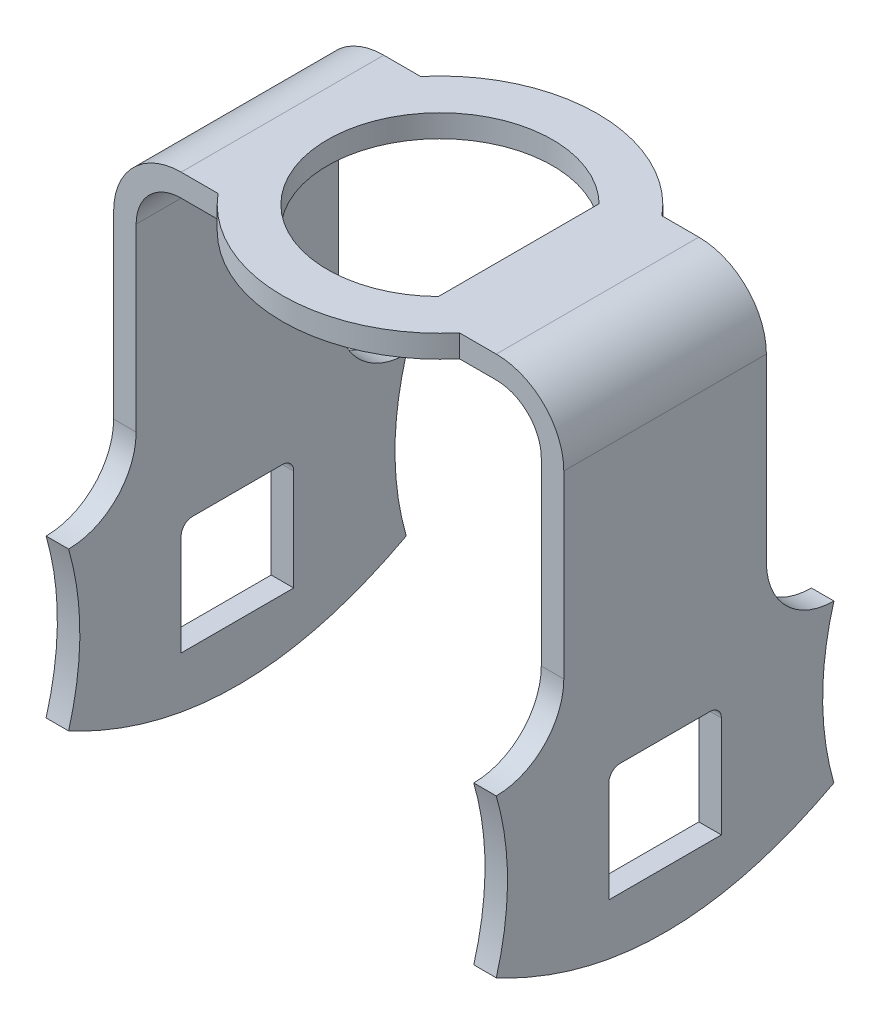
from build123d import *

# Parameters (mm, degrees)
BOSS_EXTRUDE1_DEPTH = 15
CUT_EXTRUDE2_DEPTH  = 34.970575503
CUT_EXTRUDE3_DEPTH  = 14
CUT_EXTRUDE4_DEPTH  = 34.970575503
CUT_EXTRUDE5_DEPTH  = 34.970575606
FILLET1_R           = 3
FILLET2_R           = 3
SKETCH7_W           = 5
SKETCH7_H           = 5
CUT_EXTRUDE6_DEPTH  = 34.970575606
FILLET3_R           = 0.5


with BuildPart() as part:
    # Sketch1 → Boss-Extrude1 (new body)
    with BuildSketch(Plane.XY):
        with BuildLine():
            Line((-19, 0), (-19, 20))
            ThreePointArc((-19, 20), (-18.414213562, 21.414213562), (-17, 22))
            Line((-17, 22), (-3, 22))
            ThreePointArc((-3, 22), (-1.585786438, 21.414213562), (-1, 20))
            Line((-1, 20), (-1, 0))
            Line((-1, 0), (0, 0))
            Line((0, 0), (0, 20))
            ThreePointArc((0, 20), (-0.878679656, 22.121320344), (-3, 23))
            Line((-3, 23), (-17, 23))
            ThreePointArc((-17, 23), (-19.121320344, 22.121320344), (-20, 20))
            Line((-20, 20), (-20, 0))
            Line((-20, 0), (-19, 0))
        make_face()
    extrude(amount=BOSS_EXTRUDE1_DEPTH)

    # Sketch2 → Cut-Extrude2 (cut, through all)
    with BuildSketch(Plane(origin=(0, 23, 0), x_dir=(1, 0, 0), z_dir=(0, 1, 0))):
        with BuildLine():
            Line((-6.5, -11.070714214), (-6.5, -3.929285786))
            ThreePointArc((-6.5, -3.929285786), (-15, -7.5), (-6.5, -11.070714214))
        make_face()
    extrude(amount=-CUT_EXTRUDE2_DEPTH, mode=Mode.SUBTRACT)

    # Sketch4 → Cut-Extrude3 (cut)
    with BuildSketch(Plane(origin=(0, 23, 0), x_dir=(1, 0, 0), z_dir=(0, 1, 0))):
        with BuildLine():
            Line((-4.638097353, -12), (0, -12))
            Line((0, -12), (0, -15))
            Line((0, -15), (-20, -15))
            Line((-20, -15), (-20, -12))
            Line((-20, -12), (-15.361902647, -12))
            ThreePointArc((-15.361902647, -12), (-10, -14.5), (-4.638097353, -12))
        make_face()
        with BuildLine():
            Line((-4.638097353, -3), (0, -3))
            Line((0, -3), (0, 0))
            Line((0, 0), (-20, 0))
            Line((-20, 0), (-20, -3))
            Line((-20, -3), (-15.361902647, -3))
            ThreePointArc((-15.361902647, -3), (-10, -0.5), (-4.638097353, -3))
        make_face()
    extrude(amount=-CUT_EXTRUDE3_DEPTH, mode=Mode.SUBTRACT)

    # Sketch5 → Cut-Extrude4 (cut, through all)
    with BuildSketch(Plane.ZY.offset(20)):
        with BuildLine():
            Line((0, 2), (0, 0))
            Line((0, 0), (7.5, 0))
            add(Edge.make_bspline(
                [(0, 2), (3.75, 0), (7.5, 0)],
                knots=[0, 0, 0, 0.5, 0.5, 0.5], degree=2))
        make_face()
        with BuildLine():
            add(Edge.make_bspline(
                [(7.5, 0), (11.25, 0), (15, 2)],
                knots=[0.5, 0.5, 0.5, 1, 1, 1], degree=2))
            Line((7.5, 0), (15, 0))
            Line((15, 0), (15, 2))
        make_face()
    extrude(amount=-CUT_EXTRUDE4_DEPTH, mode=Mode.SUBTRACT)

    # Sketch6 → Cut-Extrude5 (cut, through all)
    with BuildSketch(Plane.ZY.offset(20)):
        with BuildLine():
            Line((0, 9), (0, 5.5))
            Line((0, 5.5), (0.5, 5.5))
            add(Edge.make_bspline(
                [(0, 9), (0.5, 7.25), (0.5, 5.5)],
                knots=[0, 0, 0, 0.5, 0.5, 0.5], degree=2))
        make_face()
        with BuildLine():
            Line((0.5, 5.5), (0, 5.5))
            Line((0, 5.5), (0, 2))
            add(Edge.make_bspline(
                [(0.5, 5.5), (0.5, 3.75), (0, 2)],
                knots=[0.5, 0.5, 0.5, 1, 1, 1], degree=2))
        make_face()
        with BuildLine():
            Line((15, 9), (15, 2))
            add(Edge.make_bspline(
                [(15, 9), (14, 5.5), (15, 2)],
                knots=[0, 0, 0, 1, 1, 1], degree=2))
        make_face()
    extrude(amount=-CUT_EXTRUDE5_DEPTH, mode=Mode.SUBTRACT)

    # Fillet1
    fillet1_edges = [part.edges().sort_by_distance(p)[0] for p in [
        (-19.5, 9, 3),
    ]]
    fillet(fillet1_edges, radius=FILLET1_R - 0.0001)  # a hair under: the kernel refuses the full size

    # Fillet2
    fillet2_edges = [part.edges().sort_by_distance(p)[0] for p in [
        (-0.5, 9, 3),
        (-0.5, 9, 12),
        (-19.5, 9, 12),
    ]]
    fillet(fillet2_edges, radius=FILLET2_R - 0.0001)  # a hair under: the kernel refuses the full size

    # Sketch7 → Cut-Extrude6 (cut, through all)
    with BuildSketch(Plane.ZY.offset(20)):
        with Locations((7.5, 5)):
            Rectangle(SKETCH7_W, SKETCH7_H)
    extrude(amount=-CUT_EXTRUDE6_DEPTH, mode=Mode.SUBTRACT)

    # Fillet3
    fillet3_edges = [part.edges().sort_by_distance(p)[0] for p in [
        (-0.5, 7.5, 5),
        (-19.5, 7.5, 5),
        (-0.5, 7.5, 10),
        (-19.5, 7.5, 10),
    ]]
    fillet(fillet3_edges, radius=FILLET3_R)


solid = part.part
